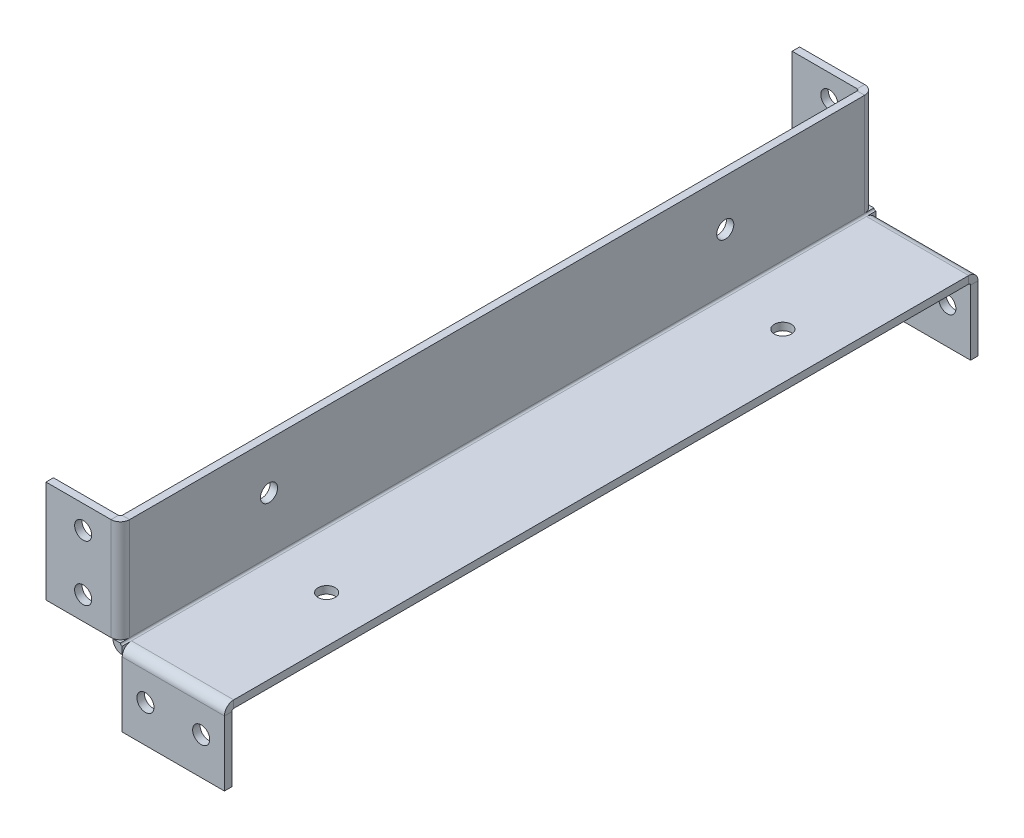
from build123d import *

# Parameters (mm, degrees)
SKETCH1_W                      = 60
SKETCH1_H                      = 405.5
BASE_FLANGE1_DEPTH             = 4
EDGE_FLANGE1_STRIP_W           = 18
EDGE_FLANGE1_STRIP_H           = 4
EDGE_FLANGE1_STRIP_CUT_DEPTH   = 405.5
EDGE_FLANGE1_DEPTH             = 405.5
EDGE_FLANGE2_STRIP_W           = 18
EDGE_FLANGE2_STRIP_H           = 4
EDGE_FLANGE2_STRIP_CUT_DEPTH   = 55
EDGE_FLANGE2_STRIP_2_W         = 18
EDGE_FLANGE2_STRIP_2_H         = 4
EDGE_FLANGE2_STRIP_CUT_2_DEPTH = 55
EDGE_FLANGE2_STRIP_3_W         = 18
EDGE_FLANGE2_STRIP_3_H         = 4
EDGE_FLANGE2_STRIP_CUT_3_DEPTH = 55
EDGE_FLANGE2_STRIP_4_W         = 18
EDGE_FLANGE2_STRIP_4_H         = 4
EDGE_FLANGE2_STRIP_CUT_4_DEPTH = 55
EDGE_FLANGE2_DEPTH             = 55
EDGE_FLANGE2_BEND_DEPTH        = 55
EDGE_FLANGE2_BEND_2_DEPTH      = 55
EDGE_FLANGE2_BEND_3_DEPTH      = 55
SKETCH18_R                     = 4.6
EXTRUDE1_DEPTH                 = 416.194231655
SKETCH19_R                     = 4.6
EXTRUDE2_DEPTH                 = 4
SKETCH20_R                     = 4.6
EXTRUDE3_DEPTH                 = 4


# Sheet-metal steps are written as plain solids
with BuildPart() as part:
    # Sketch1 → Base-Flange1 (new body)
    with BuildSketch(Plane(origin=(0, 0, 0), x_dir=(1, 0, 0), z_dir=(0, 1, 0))):
        Rectangle(SKETCH1_W, SKETCH1_H)
    extrude(amount=BASE_FLANGE1_DEPTH)

    # Edge-Flange1 strip (across the edge) → Edge-Flange1 strip cut (cut)
    with BuildSketch(Plane(origin=(-30, 4, -202.75), x_dir=(1, 0, 0), z_dir=(0, 0, 1))):
        with Locations((-4, -2)):
            Rectangle(EDGE_FLANGE1_STRIP_W, EDGE_FLANGE1_STRIP_H)
    extrude(amount=EDGE_FLANGE1_STRIP_CUT_DEPTH, mode=Mode.SUBTRACT)

    # Edge-Flange1 section (across the edge) → Edge-Flange1 (add)
    with BuildSketch(Plane(origin=(-30, 4, -202.75), x_dir=(1, 0, 0), z_dir=(0, 0, 1))):
        with BuildLine():
            Line((0, 1), (0, 56))
            Line((0, 56), (4, 56))
            Line((4, 56), (4, 1))
            ThreePointArc((4, 1), (4.292893219, 0.292893219), (5, 0))
            Line((5, 0), (5, -4))
            ThreePointArc((5, -4), (1.464466094, -2.535533906), (0, 1))
        make_face()
    extrude(amount=EDGE_FLANGE1_DEPTH)

    # Edge-Flange2 strip (across the edge) → Edge-Flange2 strip cut (cut)
    with BuildSketch(Plane(origin=(-30, 5, 202.75), x_dir=(0, 0, -1), z_dir=(0, 1, 0))):
        with Locations((-4, -2)):
            Rectangle(EDGE_FLANGE2_STRIP_W, EDGE_FLANGE2_STRIP_H)
    extrude(amount=EDGE_FLANGE2_STRIP_CUT_DEPTH, mode=Mode.SUBTRACT)

    # Edge-Flange2 strip 2 (across the edge) → Edge-Flange2 strip cut 2 (cut)
    with BuildSketch(Plane(origin=(30, 0, 202.75), x_dir=(0, 0, -1), z_dir=(-1, 0, 0))):
        with Locations((-4, -2)):
            Rectangle(EDGE_FLANGE2_STRIP_2_W, EDGE_FLANGE2_STRIP_2_H)
    extrude(amount=EDGE_FLANGE2_STRIP_CUT_2_DEPTH, mode=Mode.SUBTRACT)

    # Edge-Flange2 strip 3 (across the edge) → Edge-Flange2 strip cut 3 (cut)
    with BuildSketch(Plane(origin=(-30, 60, -202.75), x_dir=(0, 0, 1), z_dir=(0, -1, 0))):
        with Locations((-4, -2)):
            Rectangle(EDGE_FLANGE2_STRIP_3_W, EDGE_FLANGE2_STRIP_3_H)
    extrude(amount=EDGE_FLANGE2_STRIP_CUT_3_DEPTH, mode=Mode.SUBTRACT)

    # Edge-Flange2 strip 4 (across the edge) → Edge-Flange2 strip cut 4 (cut)
    with BuildSketch(Plane(origin=(-25, 0, -202.75), x_dir=(0, 0, 1), z_dir=(1, 0, 0))):
        with Locations((-4, -2)):
            Rectangle(EDGE_FLANGE2_STRIP_4_W, EDGE_FLANGE2_STRIP_4_H)
    extrude(amount=EDGE_FLANGE2_STRIP_CUT_4_DEPTH, mode=Mode.SUBTRACT)

    # Edge-Flange2 section (across the edge) → Edge-Flange2 (add)
    with BuildSketch(Plane(origin=(-30, 5, 202.75), x_dir=(0, 0, -1), z_dir=(0, 1, 0))):
        with BuildLine():
            Line((0, 1), (0, 36))
            Line((0, 36), (4, 36))
            Line((4, 36), (4, 1))
            ThreePointArc((4, 1), (4.292893219, 0.292893219), (5, 0))
            Line((5, 0), (5, -4))
            ThreePointArc((5, -4), (1.464466094, -2.535533906), (0, 1))
        make_face()
    extrude(amount=EDGE_FLANGE2_DEPTH)

    # Edge-Flange2 section 2 (across the edge) → Edge-Flange2 bend (add)
    with BuildSketch(Plane(origin=(30, 0, 202.75), x_dir=(0, 0, -1), z_dir=(-1, 0, 0))):
        with BuildLine():
            Line((0, 1), (0, 36))
            Line((0, 36), (4, 36))
            Line((4, 36), (4, 1))
            ThreePointArc((4, 1), (4.292893219, 0.292893219), (5, 0))
            Line((5, 0), (5, -4))
            ThreePointArc((5, -4), (1.464466094, -2.535533906), (0, 1))
        make_face()
    extrude(amount=EDGE_FLANGE2_BEND_DEPTH)

    # Edge-Flange2 section 3 (across the edge) → Edge-Flange2 bend 2 (add)
    with BuildSketch(Plane(origin=(-30, 60, -202.75), x_dir=(0, 0, 1), z_dir=(0, -1, 0))):
        with BuildLine():
            Line((0, 1), (0, 36))
            Line((0, 36), (4, 36))
            Line((4, 36), (4, 1))
            ThreePointArc((4, 1), (4.292893219, 0.292893219), (5, 0))
            Line((5, 0), (5, -4))
            ThreePointArc((5, -4), (1.464466094, -2.535533906), (0, 1))
        make_face()
    extrude(amount=EDGE_FLANGE2_BEND_2_DEPTH)

    # Edge-Flange2 section 4 (across the edge) → Edge-Flange2 bend 3 (add)
    with BuildSketch(Plane(origin=(-25, 0, -202.75), x_dir=(0, 0, 1), z_dir=(1, 0, 0))):
        with BuildLine():
            Line((0, 1), (0, 36))
            Line((0, 36), (4, 36))
            Line((4, 36), (4, 1))
            ThreePointArc((4, 1), (4.292893219, 0.292893219), (5, 0))
            Line((5, 0), (5, -4))
            ThreePointArc((5, -4), (1.464466094, -2.535533906), (0, 1))
        make_face()
    extrude(amount=EDGE_FLANGE2_BEND_3_DEPTH)

    # Sketch18 → Extrude1 (cut, through all)
    with BuildSketch(Plane.XY.offset(202.75)):
        with Locations((-46, 47.5)):
            Circle(SKETCH18_R)
        with Locations((-46, 17.5)):
            Circle(SKETCH18_R)
        with Locations((-12.5, -16)):
            Circle(SKETCH18_R)
        with Locations((17.5, -16)):
            Circle(SKETCH18_R)
    extrude(amount=-EXTRUDE1_DEPTH, mode=Mode.SUBTRACT)

    # Sketch19 → Extrude2 (cut)
    with BuildSketch(Plane(origin=(-26, 0, 0), x_dir=(0, 0, -1), z_dir=(1, 0, 0))):
        with Locations(Location((-122.75, 35, 0), (0, 0, 90))):
            Circle(SKETCH19_R)
        with Locations(Location((122.75, 35, 0), (0, 0, 90))):
            Circle(SKETCH19_R)
    extrude(amount=-EXTRUDE2_DEPTH, mode=Mode.SUBTRACT)

    # Sketch20 → Extrude3 (cut)
    with BuildSketch(Plane(origin=(0, 4, 0), x_dir=(1, 0, 0), z_dir=(0, 1, 0))):
        with Locations(Location((5, 122.75, 0), (0, 0, 270))):
            Circle(SKETCH20_R)
        with Locations(Location((5, -122.75, 0), (0, 0, 270))):
            Circle(SKETCH20_R)
    extrude(amount=-EXTRUDE3_DEPTH, mode=Mode.SUBTRACT)


solid = part.part
